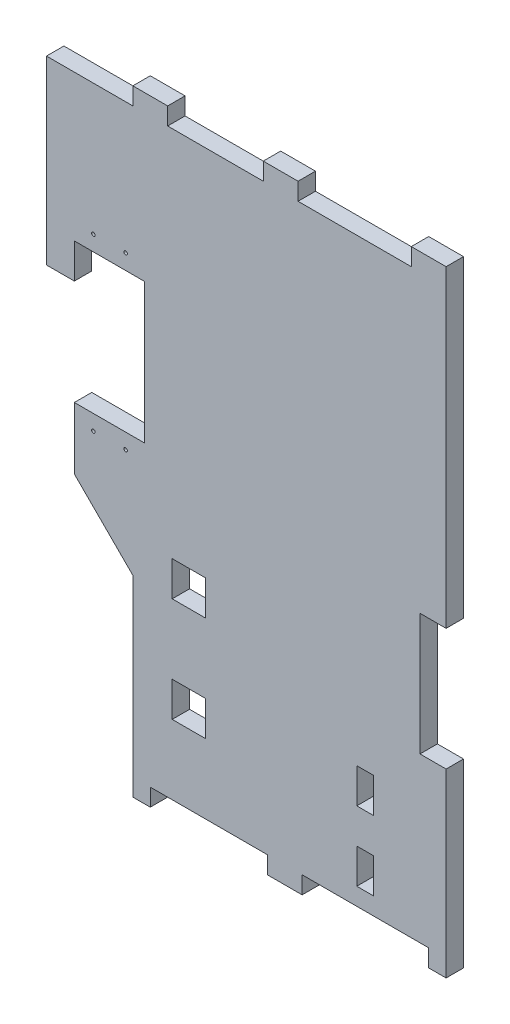
from build123d import *

# Parameters (mm, degrees)
ESQUISSE1_W             = 4.807532778
ESQUISSE1_H             = 10
ESQUISSE1_W_2           = 9.57980661
BOSS_EXTRU_1_DEPTH      = 5
BOSS_EXTRU_2_DEPTH      = 5
ESQUISSE3_W             = 20.2
ESQUISSE3_H             = 40.2
ENL_V_MAT_EXTRU_1_DEPTH = 5
ESQUISSE4_W             = 8
ESQUISSE4_H             = 52
ESQUISSE4_W_2           = 10
ESQUISSE4_H_2           = 5
ESQUISSE4_W_3           = 5
BOSS_EXTRU_3_DEPTH      = 5
ESQUISSE5_R             = 0.5
ENL_V_MAT_EXTRU_2_DEPTH = 5


with BuildPart() as part:
    # Esquisse1 → Boss.-Extru.1 (new body)
    with BuildSketch(Plane.XY):
        Polygon((90, 82), (90, 167), (90, 172), (80, 172), (80, 167), (10, 167), (10, 172), (0, 172), (0, 167), (0, 0), (0, -5), (5, -5), (5, 0), (90, 0), (90, 47), (82.5, 47), (82.5, 82), align=None)
        with Locations((66.738521132, 30)):
            Rectangle(ESQUISSE1_W, ESQUISSE1_H, mode=Mode.SUBTRACT)
        with Locations((66.738521132, 10)):
            Rectangle(ESQUISSE1_W, ESQUISSE1_H, mode=Mode.SUBTRACT)
        with Locations((16.093272864, 25)):
            Rectangle(ESQUISSE1_W_2, ESQUISSE1_H, mode=Mode.SUBTRACT)
        with Locations((16.093272864, 55)):
            Rectangle(ESQUISSE1_W_2, ESQUISSE1_H, mode=Mode.SUBTRACT)
    extrude(amount=BOSS_EXTRU_1_DEPTH)

    # Esquisse2 → Boss.-Extru.2 (add)
    with BuildSketch(Plane.XY.offset(5)):
        Polygon((0, 167), (-16.814476947, 167), (-16.814476947, 67), (0, 50.185523053), align=None)
    extrude(amount=-BOSS_EXTRU_2_DEPTH)

    # Esquisse3 → Enlèv. mat.-Extru.1 (cut)
    with BuildSketch(Plane.XY.offset(5)):
        with Locations((-6.714476947, 104.9)):
            Rectangle(ESQUISSE3_W, ESQUISSE3_H)
    extrude(amount=-ENL_V_MAT_EXTRU_1_DEPTH, mode=Mode.SUBTRACT)

    # Esquisse4 → Boss.-Extru.3 (add)
    with BuildSketch(Plane.XY.offset(5)):
        with Locations((-20.814476947, 141)):
            Rectangle(ESQUISSE4_W, ESQUISSE4_H)
        with Locations((43.633734486, -2.5)):
            Rectangle(ESQUISSE4_W_2, ESQUISSE4_H_2)
        with Locations((87.5, -2.5)):
            Rectangle(ESQUISSE4_W_3, ESQUISSE4_H_2)
        with Locations((42.466362442, 169.5)):
            Rectangle(ESQUISSE4_W_2, ESQUISSE4_H_2)
    extrude(amount=-BOSS_EXTRU_3_DEPTH)

    # Esquisse5 → Enlèv. mat.-Extru.2 (cut)
    with BuildSketch(Plane.XY.offset(5)):
        with Locations((-11.339476947, 129.4)):
            Circle(ESQUISSE5_R)
        with Locations((-2.089476947, 129.4)):
            Circle(ESQUISSE5_R)
        with Locations((-11.339476947, 80.4)):
            Circle(ESQUISSE5_R)
        with Locations((-2.089476947, 80.4)):
            Circle(ESQUISSE5_R)
    extrude(amount=-ENL_V_MAT_EXTRU_2_DEPTH, mode=Mode.SUBTRACT)


solid = part.part
